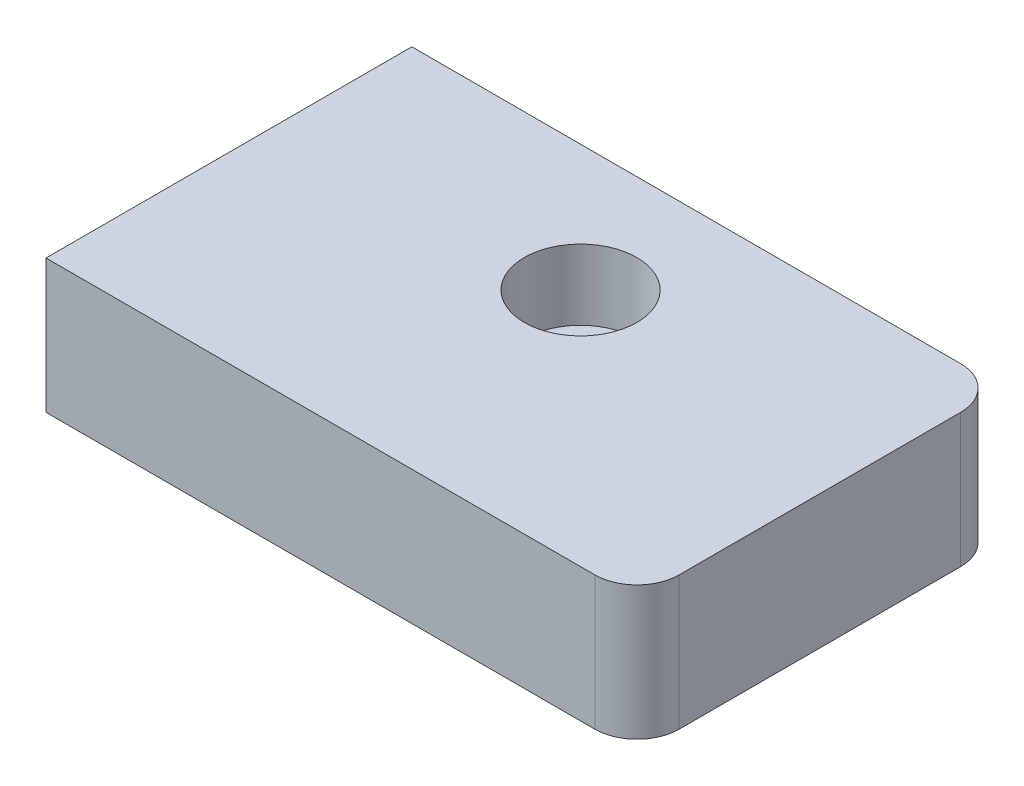
from build123d import *

# Parameters (mm, degrees)
SKETCH_1_W          = 42
SKETCH_1_H          = 26
EXTRUDE_1_DEPTH     = 9.5
SKETCH_2_R          = 4
CUT_EXTRUDE_1_DEPTH = 5
FILLET_1_R          = 3


with BuildPart() as part:
    # 草图1 → 凸台-拉伸1 (new body)
    with BuildSketch(Plane(origin=(0, 0, 0), x_dir=(1, 0, 0), z_dir=(0, 1, 0))):
        Rectangle(SKETCH_1_W, SKETCH_1_H)
    extrude(amount=EXTRUDE_1_DEPTH)

    # 草图2 → 切除-拉伸1 (cut)
    with BuildSketch(Plane(origin=(0, 9.5, 0), x_dir=(1, 0, 0), z_dir=(0, 1, 0))):
        with Locations((-0.035567837, 4.026194604)):
            Circle(SKETCH_2_R)
    extrude(amount=-CUT_EXTRUDE_1_DEPTH, mode=Mode.SUBTRACT)

    # 圆角1
    fillet_1_edges = [part.edges().sort_by_distance(p)[0] for p in [
        (21, 4.75, -13),
        (21, 4.75, 13),
    ]]
    fillet(fillet_1_edges, radius=FILLET_1_R)


solid = part.part
